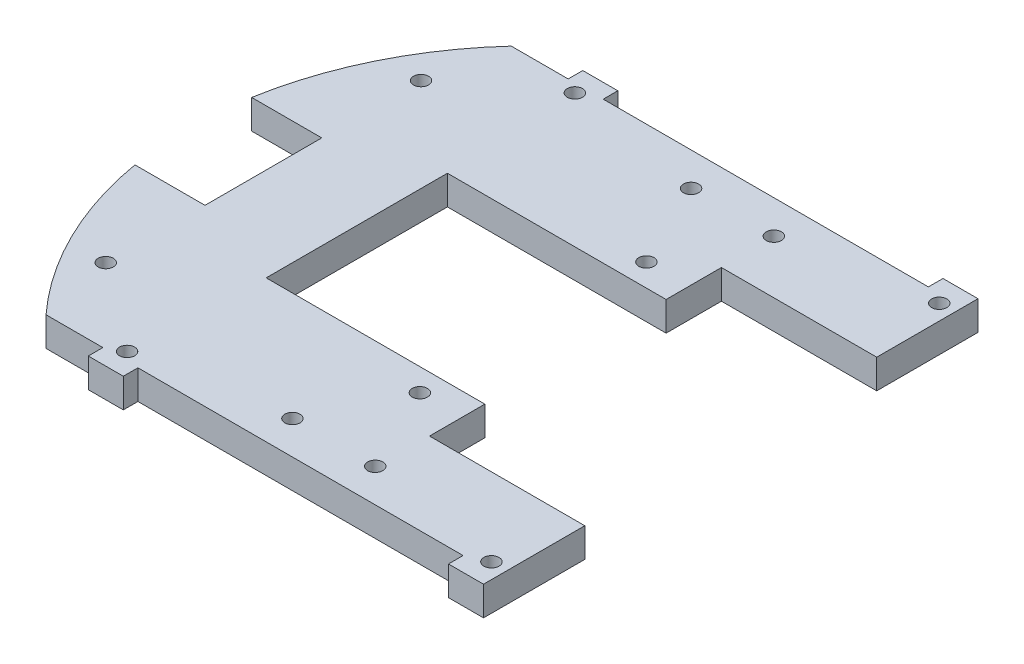
from build123d import *

# Parameters (mm, degrees)
SKETCH1_R           = 1.651
BOSS_EXTRUDE1_DEPTH = 6.35


with BuildPart() as part:
    # Sketch1 → Boss-Extrude1 (new body)
    with BuildSketch(Plane(origin=(0, 0, 0), x_dir=(1, 0, 0), z_dir=(0, 1, 0))):
        with BuildLine():
            Line((33.776652136, 5.898881649), (4.627239322, 5.898881649))
            Line((4.627239322, 5.898881649), (4.627239322, 45.322727236))
            Line((4.627239322, 45.322727236), (33.776652136, 45.322727236))
            Line((33.776652136, 45.322727236), (52.191652136, 45.322727236))
            Line((52.191652136, 45.322727236), (52.191652136, 57.360804442))
            Line((52.191652136, 57.360804442), (85.968304273, 57.360804442))
            Line((85.968304273, 57.360804442), (85.968304273, 76.214266248))
            Line((85.968304273, 76.214266248), (85.968304273, 79.389266248))
            Line((85.968304273, 79.389266248), (78.348304273, 79.389266248))
            Line((78.348304273, 79.389266248), (78.348304273, 76.214266248))
            Line((78.348304273, 76.214266248), (7.62, 76.214266248))
            Line((7.62, 76.214266248), (7.62, 79.389266248))
            Line((7.62, 79.389266248), (0, 79.389266248))
            Line((0, 79.389266248), (0, 76.214266248))
            Line((0, 76.214266248), (-12.371874213, 76.214266248))
            ThreePointArc((-12.371874213, 76.214266248), (-24.373410945, 58.595023332), (-30.932760678, 38.310804442))
            Line((-30.932760678, 38.310804442), (-15.692760678, 38.310804442))
            Line((-15.692760678, 38.310804442), (-15.692760678, 12.910804442))
            Line((-15.692760678, 12.910804442), (-30.932760678, 12.910804442))
            ThreePointArc((-30.932760678, 12.910804442), (-24.373410945, -7.373414447), (-12.371874213, -24.992657364))
            Line((-12.371874213, -24.992657364), (0, -24.992657364))
            Line((0, -24.992657364), (0, -28.167657364))
            Line((0, -28.167657364), (7.62, -28.167657364))
            Line((7.62, -28.167657364), (7.62, -24.992657364))
            Line((7.62, -24.992657364), (78.348304273, -24.992657364))
            Line((78.348304273, -24.992657364), (78.348304273, -28.167657364))
            Line((78.348304273, -28.167657364), (85.968304273, -28.167657364))
            Line((85.968304273, -28.167657364), (85.968304273, -24.992657364))
            Line((85.968304273, -24.992657364), (85.968304273, -6.139195558))
            Line((85.968304273, -6.139195558), (52.191652136, -6.139195558))
            Line((52.191652136, -6.139195558), (52.191652136, 5.898881649))
            Line((52.191652136, 5.898881649), (33.776652136, 5.898881649))
        make_face()
        with Locations((3.357239322, -23.087657364)):
            Circle(SKETCH1_R, mode=Mode.SUBTRACT)
        with Locations((82.611064951, -23.087657364)):
            Circle(SKETCH1_R, mode=Mode.SUBTRACT)
        with Locations((42.984152136, 0.972804442)):
            Circle(SKETCH1_R, mode=Mode.SUBTRACT)
        with Locations((33.983402136, -17.742657364)):
            Circle(SKETCH1_R, mode=Mode.SUBTRACT)
        with Locations((51.983402136, -17.742657364)):
            Circle(SKETCH1_R, mode=Mode.SUBTRACT)
        with Locations((51.983402136, 68.964266248)):
            Circle(SKETCH1_R, mode=Mode.SUBTRACT)
        with Locations((33.983402136, 68.964266248)):
            Circle(SKETCH1_R, mode=Mode.SUBTRACT)
        with Locations((42.984152136, 50.248804442)):
            Circle(SKETCH1_R, mode=Mode.SUBTRACT)
        with Locations((82.611064951, 74.309266248)):
            Circle(SKETCH1_R, mode=Mode.SUBTRACT)
        with Locations((3.357239322, 74.309266248)):
            Circle(SKETCH1_R, mode=Mode.SUBTRACT)
        with Locations((-15.692760678, 59.900804442)):
            Circle(SKETCH1_R, mode=Mode.SUBTRACT)
        with Locations((-15.692760678, -8.679195558)):
            Circle(SKETCH1_R, mode=Mode.SUBTRACT)
    extrude(amount=BOSS_EXTRUDE1_DEPTH)


solid = part.part
